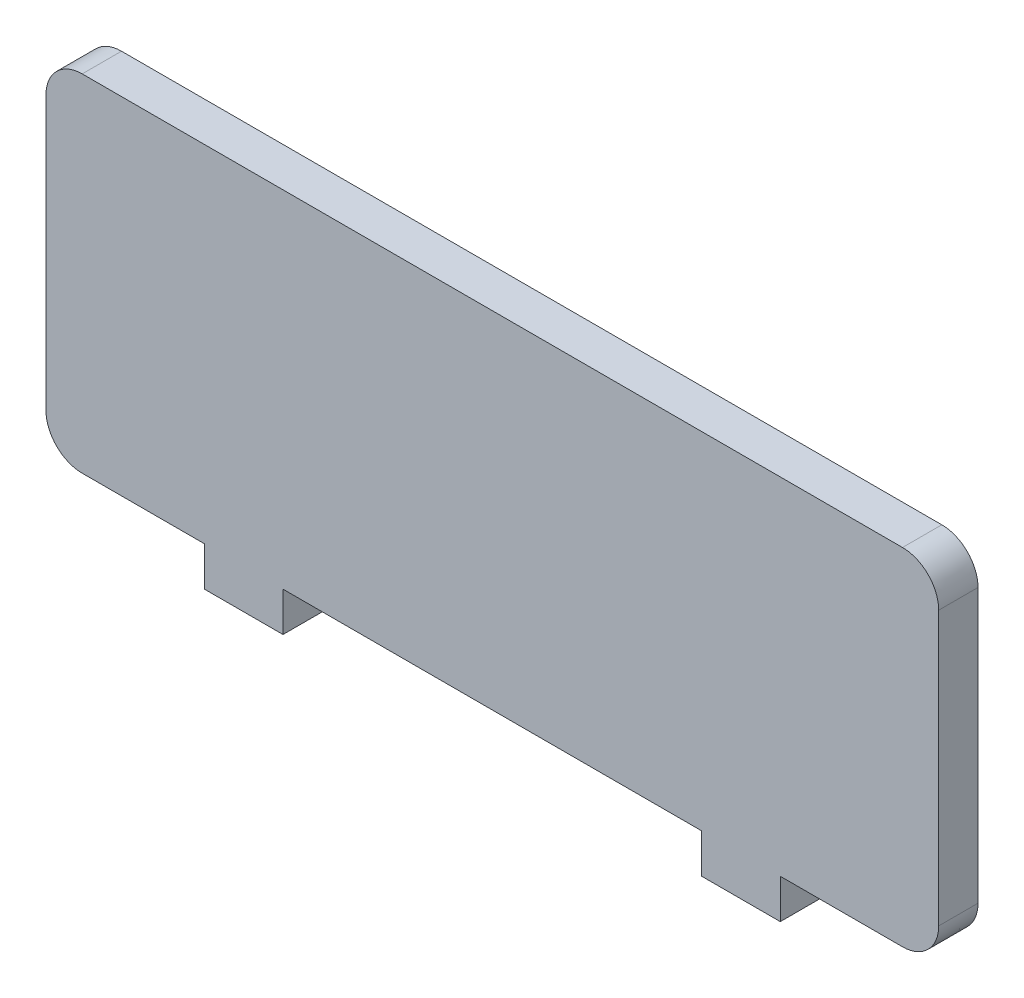
from build123d import *

# Parameters (mm, degrees)
BASE_FLANGE1_DEPTH = 2.3
SKETCH6_W          = 4.6
SKETCH6_H          = 2.3
TAB1_DEPTH         = 2.3


# Sheet-metal steps are written as plain solids
with BuildPart() as part:
    # Model → Base-Flange1 (new body)
    with BuildSketch(Plane.XY):
        with BuildLine():
            Line((286.92374396, -389.094251747), (238.923745329, -389.094251747))
            add(Edge.make_bspline(
                [(238.923745329, -389.094251747), (237.7557503, -389.094251747), (236.80552837, -390.044409082), (236.80552837, -391.212296452)],
                knots=[1, 1, 1, 1, 2, 2, 2, 2], degree=3))
            Line((236.80552837, -391.212296452), (236.80552837, -407.212353414))
            add(Edge.make_bspline(
                [(236.80552837, -407.212353414), (236.80552837, -408.380240783), (237.7557503, -409.330398118), (238.923745329, -409.330398118)],
                knots=[3, 3, 3, 3, 4, 4, 4, 4], degree=3))
            Line((238.923745329, -409.330398118), (286.92374396, -409.330398118))
            add(Edge.make_bspline(
                [(286.92374396, -409.330398118), (288.09163133, -409.330398118), (289.041788665, -408.380240783), (289.041788665, -407.212353414)],
                knots=[5, 5, 5, 5, 6, 6, 6, 6], degree=3))
            Line((289.041788665, -407.212353414), (289.041788665, -391.212296452))
            add(Edge.make_bspline(
                [(289.041788665, -391.212296452), (289.041788665, -390.044409082), (288.09163133, -389.094251747), (286.92374396, -389.094251747)],
                knots=[7, 7, 7, 7, 8, 8, 8, 8], degree=3))
        make_face()
    extrude(amount=-BASE_FLANGE1_DEPTH)

    # Sketch6 → Tab1 (add)
    with BuildSketch(Plane.XY):
        with Locations((248.373744645, -410.480398118)):
            Rectangle(SKETCH6_W, SKETCH6_H)
        with Locations((277.473744645, -410.480398118)):
            Rectangle(SKETCH6_W, SKETCH6_H)
    extrude(amount=-TAB1_DEPTH)


solid = part.part
